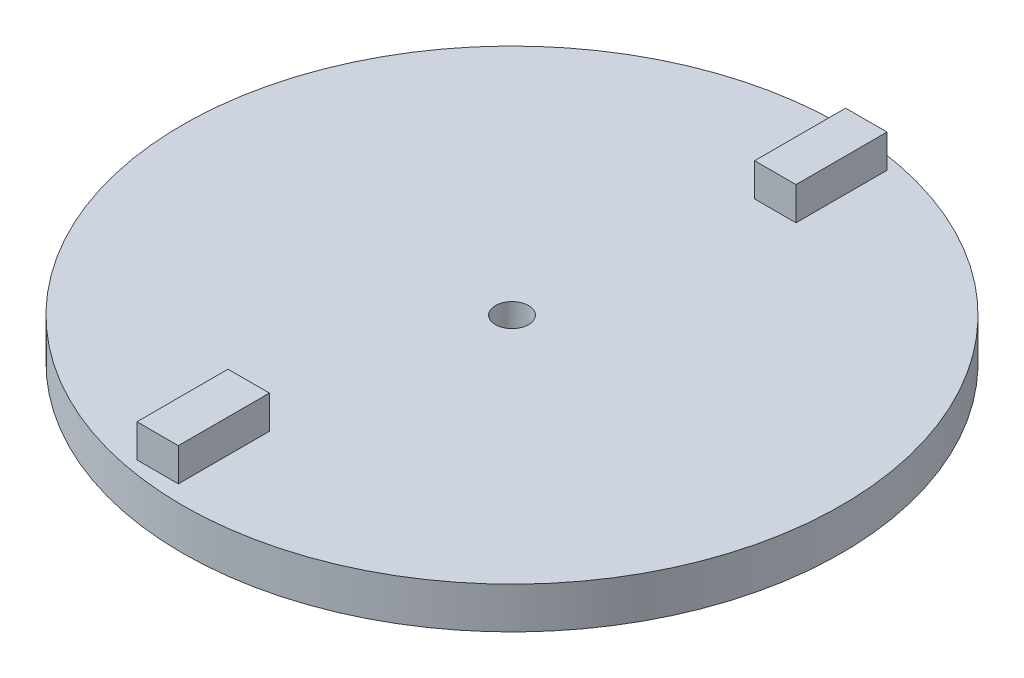
from build123d import *

# Parameters (mm, degrees)
SKETCH1_R           = 50.575792326
SKETCH1_R_2         = 2.54
BOSS_EXTRUDE1_DEPTH = 6.35
SKETCH2_W           = 13.97
SKETCH2_H           = 5.08
BOSS_EXTRUDE3_DEPTH = 9.525
SKETCH3_W           = 13.97
SKETCH3_H           = 5.08
CUT_EXTRUDE1_DEPTH  = 3.175
CIRPATTERN2_COUNT   = 2
SKETCH4_W           = 13.97
SKETCH4_H           = 5.08
CUT_EXTRUDE2_DEPTH  = 3.175


with BuildPart() as part:
    # Sketch1 → Boss-Extrude1 (new body)
    with BuildSketch(Plane(origin=(0, 0, 0), x_dir=(1, 0, 0), z_dir=(0, 1, 0))):
        Circle(SKETCH1_R)
        Circle(SKETCH1_R_2, mode=Mode.SUBTRACT)
    extrude(amount=BOSS_EXTRUDE1_DEPTH)

    # Sketch2 → Boss-Extrude3 (add)
    with BuildSketch(Plane(origin=(0, 0, 0), x_dir=(0, 0, -1), z_dir=(1, 0, 0))):
        with Locations((-41.043352, 8.89)):
            Rectangle(SKETCH2_W, SKETCH2_H)
    boss_extrude3 = extrude(amount=-BOSS_EXTRUDE3_DEPTH)

    # Sketch3 → Cut-Extrude1 (cut)
    with BuildSketch(Plane(origin=(0, 0, 0), x_dir=(0, 0, -1), z_dir=(1, 0, 0))):
        with Locations((-41.043352, 8.89)):
            Rectangle(SKETCH3_W, SKETCH3_H)
    extrude(amount=-CUT_EXTRUDE1_DEPTH, mode=Mode.SUBTRACT)

    # CirPattern2: Boss-Extrude3 ×2 about axis
    cirpattern2_axis = Axis((0, 6.35, 0), (0, 1, 0))
    for i in range(1, CIRPATTERN2_COUNT):
        add(boss_extrude3.rotate(cirpattern2_axis, i * 360 / CIRPATTERN2_COUNT))

    # Sketch4 → Cut-Extrude2 (cut)
    with BuildSketch(Plane.ZY):
        with Locations((-41.043352, 8.89)):
            Rectangle(SKETCH4_W, SKETCH4_H)
    extrude(amount=-CUT_EXTRUDE2_DEPTH, mode=Mode.SUBTRACT)


solid = part.part
